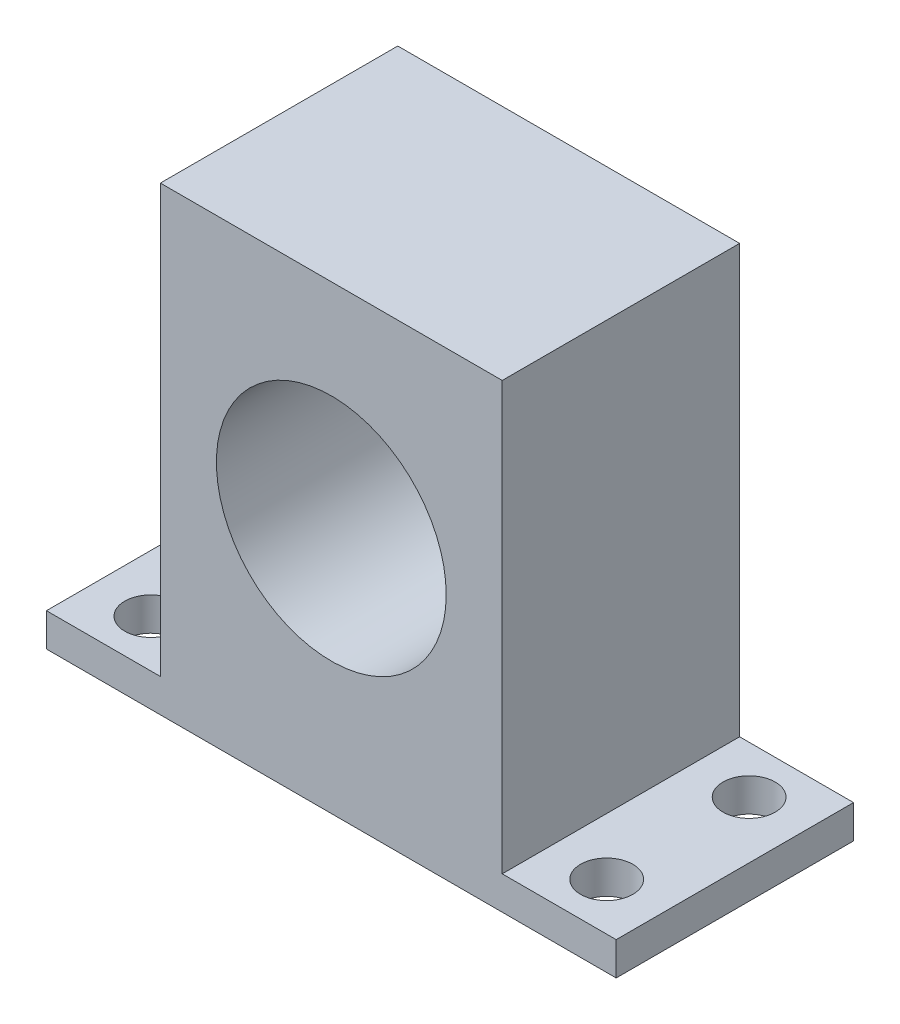
from build123d import *

# Parameters (mm, degrees)
SKETCH3_W           = 18
SKETCH3_H           = 22.5
BRACKETBASE_DEPTH   = 12.5
SKETCH4_R           = 6.05
HOLE_DEPTH          = 32.408597549
SKETCH5_W           = 30
SKETCH5_H           = 12.5
TABBASE_DEPTH       = 1.75
SKETCH6_R           = 1.375
MOUNTINGHOLES_DEPTH = 36.19232871


with BuildPart() as part:
    # Sketch3 → bracketBase (new body)
    with BuildSketch(Plane.XY):
        with Locations((9, 11.25)):
            Rectangle(SKETCH3_W, SKETCH3_H)
    extrude(amount=BRACKETBASE_DEPTH)

    # Sketch4 → hole (cut, through all)
    with BuildSketch(Plane.XY.offset(12.5)):
        with Locations((9, 11.25)):
            Circle(SKETCH4_R)
    extrude(amount=-HOLE_DEPTH, mode=Mode.SUBTRACT)

    # Sketch5 → tabBase (add)
    with BuildSketch(Plane.XZ):
        with Locations((9, 6.25)):
            Rectangle(SKETCH5_W, SKETCH5_H)
    extrude(amount=TABBASE_DEPTH)

    # Sketch6 → mountingHoles (cut, through all)
    with BuildSketch(Plane(origin=(0, 0, 0), x_dir=(1, 0, 0), z_dir=(0, 1, 0))):
        with Locations((-3, -2.5)):
            Circle(SKETCH6_R)
        with Locations((-3, -10)):
            Circle(SKETCH6_R)
        with Locations((21, -2.5)):
            Circle(SKETCH6_R)
        with Locations((21, -10)):
            Circle(SKETCH6_R)
    extrude(amount=-MOUNTINGHOLES_DEPTH, mode=Mode.SUBTRACT)


solid = part.part
